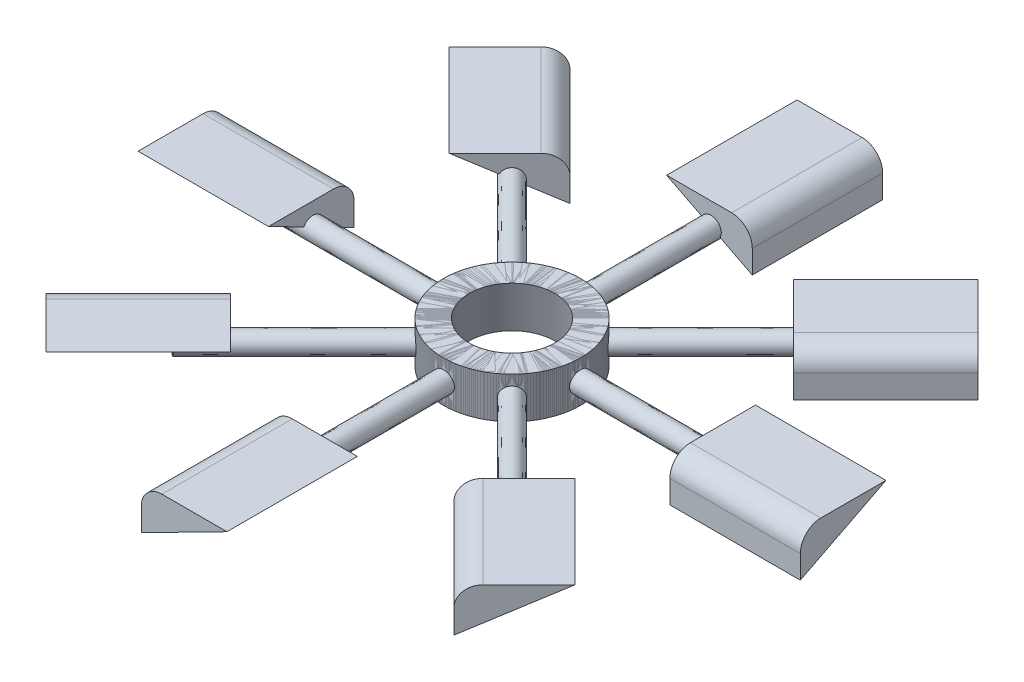
from build123d import *

# Parameters (mm, degrees)
SKETCH1_R             = 20
SKETCH1_R_2           = 12.5
BOSS_EXTRUDE1_DEPTH   = 6
BOSS_EXTRUDE4_START   = 19
BOSS_EXTRUDE4_DEPTH   = 51.00000009
BOSS_EXTRUDE4_START_2 = -4
BOSS_EXTRUDE4_2_DEPTH = 8
BOSS_EXTRUDE6_START   = 58
BOSS_EXTRUDE6_DEPTH   = 38
CIRPATTERN3_COUNT     = 8


with BuildPart() as part:
    # Sketch1 → Boss-Extrude1 (new, symmetric)
    with BuildSketch(Plane(origin=(0, 0, 0), x_dir=(1, 0, 0), z_dir=(0, 1, 0))):
        with Locations(Location((0, 0, 0), (0, 0, 270))):
            Circle(SKETCH1_R)
        with Locations(Location((0, 0, 0), (0, 0, 270))):
            Circle(SKETCH1_R_2, mode=Mode.SUBTRACT)
    extrude(amount=BOSS_EXTRUDE1_DEPTH, both=True)

    # Boss-Extrude4: read off the stored shape, not the designer's step
    # Boss-Extrude4 outline → Boss-Extrude4 (add)
    with BuildSketch(Plane.XY.offset(BOSS_EXTRUDE4_START)):
        with BuildLine():
            add(Edge.make_bspline(
                [(-3, 0), (-3, -0.793978689), (-2.673783282, -1.56897933), (-1.568389269, -2.674129442), (-0.785514487, -2.999555991), (0.782119346, -3.000443048), (1.561298853, -2.680974139), (2.679947478, -1.563060446), (2.999698138, -0.7848243), (3.000301418, 0.782514857), (2.675881918, 1.565711881), (1.57076491, 2.672918879), (0.795710582, 2.999327686), (-0.790632949, 3.000670165), (-1.566834685, 2.674960659), (-2.672563491, 1.570920062), (-3, 0.793978689), (-3, 0)],
                knots=[0, 0, 0, 0, 0.125, 0.125, 0.25, 0.25, 0.375, 0.375, 0.5, 0.5, 0.625, 0.625, 0.75, 0.75, 0.875, 0.875, 1, 1, 1, 1], degree=3))
        make_face()
    extrude(amount=BOSS_EXTRUDE4_DEPTH)

    # Boss-Extrude4 2 outline → Boss-Extrude4 2 (cut)
    with BuildSketch(Plane(origin=(0, 0, 0), x_dir=(1, 0, 0), z_dir=(0, 1, 0)).offset(BOSS_EXTRUDE4_START_2)):
        with BuildLine():
            Line((4, -69.621454152), (3.010672171, -69.772097842))
            ThreePointArc((3.010672171, -69.772097842), (1.509642865, -69.942943073), (1e-09, -70))
            Line((1e-09, -70), (4, -70.00000009))
            Line((4, -70.00000009), (4, -69.621454152))
        make_face()
        with BuildLine():
            Line((-4, -70.00000009), (1e-09, -70))
            ThreePointArc((1e-09, -70), (-1.504260837, -69.943349752), (-3, -69.773719933))
            Line((-3, -69.773719933), (-4, -69.622003411))
            Line((-4, -69.622003411), (-4, -70.00000009))
        make_face()
    extrude(amount=BOSS_EXTRUDE4_2_DEPTH, mode=Mode.SUBTRACT)


with BuildPart() as body_2:
    # Sketch7 → Boss-Extrude6 (new body)
    with BuildSketch(Plane.XY.offset(BOSS_EXTRUDE6_START)):
        with BuildLine():
            Line((0, 0), (-12, -6.114305394))
            Line((-12, -6.114305394), (-12, 0.596481961))
            ThreePointArc((-12, 0.596481961), (-10.242640687, 4.839122648), (-6, 6.596481961))
            Line((-6, 6.596481961), (12.946324796, 6.596481961))
            Line((12.946324796, 6.596481961), (0, 0))
        make_face()
    extrude(amount=BOSS_EXTRUDE6_DEPTH)


with BuildPart() as cirpattern3_1:
    # CirPattern3: pattern copy
    add(body_2.part.rotate(Axis((0, 6, 0), (0, -1, 0)), 1 * 360 / CIRPATTERN3_COUNT))


with BuildPart() as cirpattern3_2:
    # CirPattern3: pattern copy
    add(body_2.part.rotate(Axis((0, 6, 0), (0, -1, 0)), 2 * 360 / CIRPATTERN3_COUNT))


with BuildPart() as cirpattern3_3:
    # CirPattern3: pattern copy
    add(body_2.part.rotate(Axis((0, 6, 0), (0, -1, 0)), 3 * 360 / CIRPATTERN3_COUNT))


with BuildPart() as cirpattern3_4:
    # CirPattern3: pattern copy
    add(body_2.part.rotate(Axis((0, 6, 0), (0, -1, 0)), 4 * 360 / CIRPATTERN3_COUNT))


with BuildPart() as cirpattern3_5:
    # CirPattern3: pattern copy
    add(body_2.part.rotate(Axis((0, 6, 0), (0, -1, 0)), 5 * 360 / CIRPATTERN3_COUNT))


with BuildPart() as cirpattern3_6:
    # CirPattern3: pattern copy
    add(body_2.part.rotate(Axis((0, 6, 0), (0, -1, 0)), 6 * 360 / CIRPATTERN3_COUNT))


with BuildPart() as cirpattern3_7:
    # CirPattern3: pattern copy
    add(body_2.part.rotate(Axis((0, 6, 0), (0, -1, 0)), 7 * 360 / CIRPATTERN3_COUNT))


with BuildPart() as cirpattern3_8:
    # CirPattern3: pattern copy
    add(part.part.rotate(Axis((0, 6, 0), (0, -1, 0)), 1 * 360 / CIRPATTERN3_COUNT))


with BuildPart() as cirpattern3_9:
    # CirPattern3: pattern copy
    add(part.part.rotate(Axis((0, 6, 0), (0, -1, 0)), 2 * 360 / CIRPATTERN3_COUNT))


with BuildPart() as cirpattern3_10:
    # CirPattern3: pattern copy
    add(part.part.rotate(Axis((0, 6, 0), (0, -1, 0)), 3 * 360 / CIRPATTERN3_COUNT))


with BuildPart() as cirpattern3_11:
    # CirPattern3: pattern copy
    add(part.part.rotate(Axis((0, 6, 0), (0, -1, 0)), 4 * 360 / CIRPATTERN3_COUNT))


with BuildPart() as cirpattern3_12:
    # CirPattern3: pattern copy
    add(part.part.rotate(Axis((0, 6, 0), (0, -1, 0)), 5 * 360 / CIRPATTERN3_COUNT))


with BuildPart() as cirpattern3_13:
    # CirPattern3: pattern copy
    add(part.part.rotate(Axis((0, 6, 0), (0, -1, 0)), 6 * 360 / CIRPATTERN3_COUNT))


with BuildPart() as cirpattern3_14:
    # CirPattern3: pattern copy
    add(part.part.rotate(Axis((0, 6, 0), (0, -1, 0)), 7 * 360 / CIRPATTERN3_COUNT))


solid = Compound([part.part, body_2.part, cirpattern3_1.part, cirpattern3_2.part, cirpattern3_3.part, cirpattern3_4.part, cirpattern3_5.part, cirpattern3_6.part, cirpattern3_7.part, cirpattern3_8.part, cirpattern3_9.part, cirpattern3_10.part, cirpattern3_11.part, cirpattern3_12.part, cirpattern3_13.part, cirpattern3_14.part])
